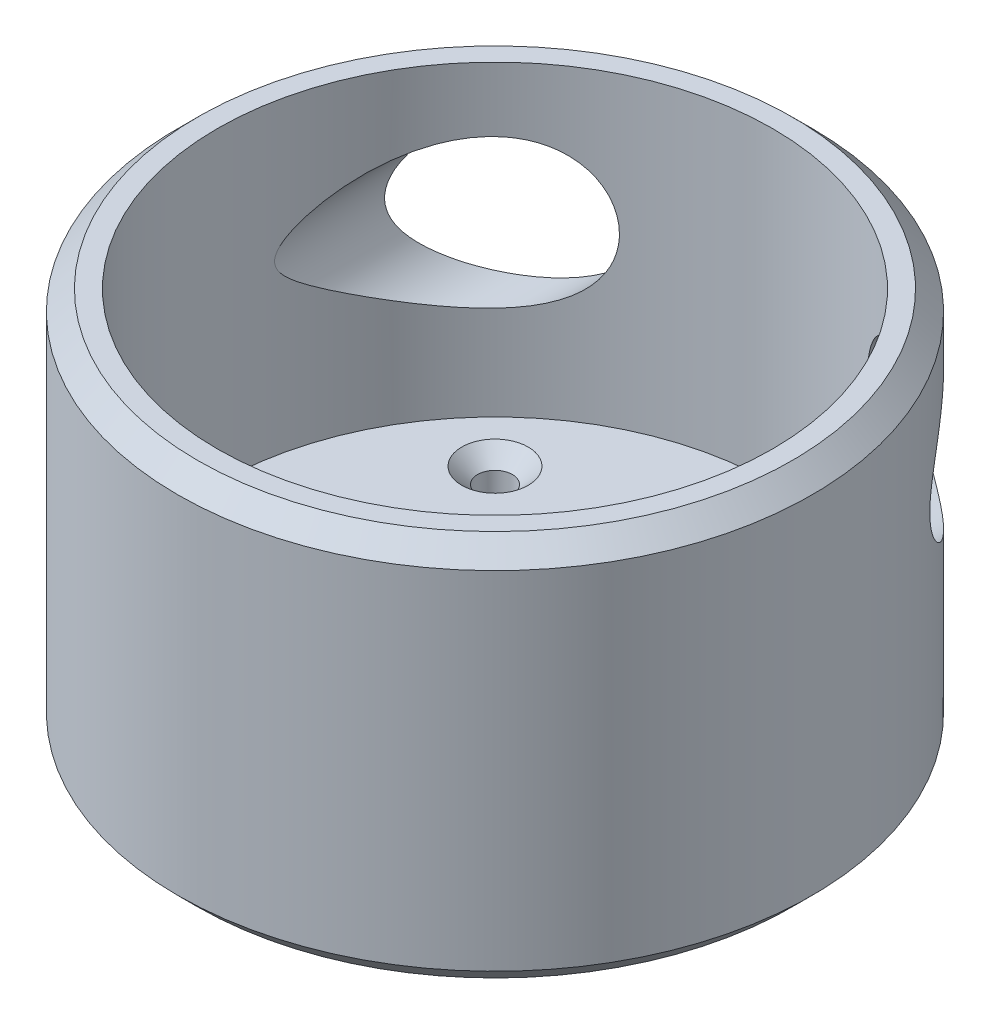
from build123d import *

# Parameters (mm, degrees)
SKETCH2_R           = 32
SKETCH2_R_2         = 28
BOSS_EXTRUDE1_DEPTH = 39
SKETCH3_R           = 28
BOSS_EXTRUDE2_DEPTH = 8
SKETCH4_R           = 8
CUT_EXTRUDE1_DEPTH  = 3
SKETCH5_R           = 2.6
SKETCH5_R_2         = 1.75
CUT_EXTRUDE2_DEPTH  = 55.854352608
CHAMFER1_SIZE       = 1.6
SKETCH6_R           = 12.5
CUT_EXTRUDE3_DEPTH  = 2.5
CHAMFER2_SIZE       = 2
CHAMFER3_SIZE       = 2
SKETCH7_R           = 7.5
CUT_EXTRUDE4_DEPTH  = 60.741108125


with BuildPart() as part:
    # Sketch2 → Boss-Extrude1 (new body)
    with BuildSketch(Plane(origin=(0, 0, 0), x_dir=(1, 0, 0), z_dir=(0, 1, 0))):
        Circle(SKETCH2_R)
        Circle(SKETCH2_R_2, mode=Mode.SUBTRACT)
    extrude(amount=BOSS_EXTRUDE1_DEPTH)

    # Sketch3 → Boss-Extrude2 (add)
    with BuildSketch(Plane.XZ):
        Circle(SKETCH3_R)
    extrude(amount=-BOSS_EXTRUDE2_DEPTH)

    # Sketch4 → Cut-Extrude1 (cut)
    with BuildSketch(Plane(origin=(0, 8, 0), x_dir=(1, 0, 0), z_dir=(0, 1, 0))):
        Circle(SKETCH4_R)
    extrude(amount=-CUT_EXTRUDE1_DEPTH, mode=Mode.SUBTRACT)

    # Sketch5 → Cut-Extrude2 (cut, through all)
    with BuildSketch(Plane(origin=(0, 8, 0), x_dir=(1, 0, 0), z_dir=(0, 1, 0))):
        Circle(SKETCH5_R)
        with Locations((-15.5, 15.5)):
            Circle(SKETCH5_R_2)
        with Locations((15.5, 15.5)):
            Circle(SKETCH5_R_2)
        with Locations((-15.5, -15.5)):
            Circle(SKETCH5_R_2)
        with Locations((15.5, -15.5)):
            Circle(SKETCH5_R_2)
    extrude(amount=-CUT_EXTRUDE2_DEPTH, mode=Mode.SUBTRACT)

    # Chamfer1
    chamfer1_edges = [part.edges().sort_by_distance(p)[0] for p in [
        (13.75, 8, -15.5),
        (13.75, 8, 15.5),
        (-17.25, 8, 15.5),
        (-17.25, 8, -15.5),
    ]]
    chamfer(chamfer1_edges, length=CHAMFER1_SIZE)

    # Sketch6 → Cut-Extrude3 (cut)
    with BuildSketch(Plane.XZ):
        Circle(SKETCH6_R)
    extrude(amount=-CUT_EXTRUDE3_DEPTH, mode=Mode.SUBTRACT)

    # Chamfer2
    chamfer2_edges = [part.edges().sort_by_distance(p)[0] for p in [
        (-32, 0, 0),
    ]]
    chamfer(chamfer2_edges, length=CHAMFER2_SIZE)

    # Chamfer3
    chamfer3_edges = [part.edges().sort_by_distance(p)[0] for p in [
        (-32, 39, 0),
    ]]
    chamfer(chamfer3_edges, length=CHAMFER3_SIZE)

    # Sketch7 → Cut-Extrude4 (cut, through all)
    with BuildSketch(Plane.XY):
        with Locations((-20, 25)):
            Circle(SKETCH7_R)
        with Locations((20, 25)):
            Circle(SKETCH7_R)
    extrude(amount=-CUT_EXTRUDE4_DEPTH, mode=Mode.SUBTRACT)


solid = part.part
